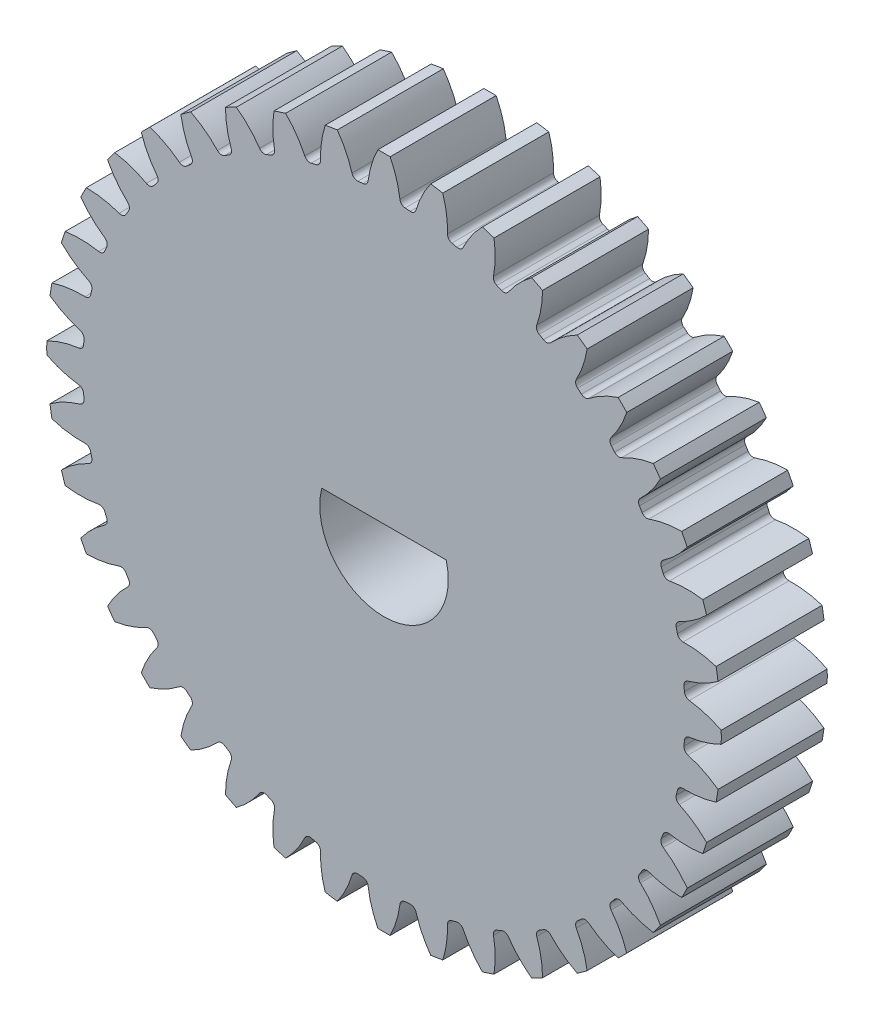
from build123d import *

# Parameters (mm, degrees)
ESQUISSE1_R                        = 1.15
BASE_EXTRUSION_DEPTH               = 2.5
BOSS_EXTRU_1_DEPTH                 = 3.3
CONG_1_R                           = 0.175
R_P_TITION_CIRCULAIRE4_COUNT       = 40
CONG_1_OF_R_P_TITION_CIRCULAIRE4_R = 0.175
ENL_V_MAT_EXTRU_1_DEPTH            = 10


with BuildPart() as part:
    # Esquisse1 → Base-Extrusion (new body)
    with BuildSketch(Plane.XY):
        Circle(ESQUISSE1_R)
    extrude(amount=BASE_EXTRUSION_DEPTH)

    # Esquisse3 → Boss.-Extru.1 (add)
    with BuildSketch(Plane.XY):
        with BuildLine():
            Line((-0.735554022, 9.346100004), (0, 0))
            Line((0, 0), (0.735554022, 9.346100004))
            ThreePointArc((0.735554022, 9.346100004), (0.623147079, 9.354267086), (0.510650079, 9.361082282))
            ThreePointArc((0.510650079, 9.361082282), (0.406217794, 9.945410374), (0.190155724, 10.498277992))
            ThreePointArc((0.190155724, 10.498277992), (0, 10.5), (-0.190155724, 10.498277992))
            ThreePointArc((-0.190155724, 10.498277992), (-0.406217794, 9.945410374), (-0.510650079, 9.361082282))
            ThreePointArc((-0.510650079, 9.361082282), (-0.623147079, 9.354267086), (-0.735554022, 9.346100004))
        make_face()
    boss_extru_1 = extrude(amount=BOSS_EXTRU_1_DEPTH)

    # Congé1
    cong_1_edges = [part.edges().sort_by_distance(p)[0] for p in [
        (0.510650079, 9.361082282, 1.65),
        (-0.510650079, 9.361082282, 1.65),
    ]]
    fillet(cong_1_edges, radius=CONG_1_R)

    # Répétition circulaire4: Boss.-Extru.1 ×40 about axis
    r_p_tition_circulaire4_axis = Axis((0, 0, 53.3), (0, 0, -1))
    for i in range(1, R_P_TITION_CIRCULAIRE4_COUNT):
        add(boss_extru_1.rotate(r_p_tition_circulaire4_axis, i * 360 / R_P_TITION_CIRCULAIRE4_COUNT))

    # Congé1 of Répétition circulaire4
    cong_1_of_r_p_tition_circulaire4_edges = [part.edges().sort_by_distance(p)[0] for p in [
        (1.968759028, 9.165948554, 1.65),
        (0.96003277, 9.325715098, 1.65),
        (3.378390596, 8.745118752, 1.65),
        (2.407076426, 9.060717857, 1.65),
        (4.704834975, 8.108955103, 1.65),
        (3.794849872, 8.572615672, 1.65),
        (5.915430703, 7.273122067, 1.65),
        (5.089181519, 7.873427238, 1.65),
        (6.980368895, 6.258200628, 1.65),
        (6.258200628, 6.980368895, 1.65),
        (7.873427238, 5.089181519, 1.65),
        (7.273122067, 5.915430703, 1.65),
        (8.572615672, 3.794849872, 1.65),
        (8.108955103, 4.704834975, 1.65),
        (9.060717857, 2.407076426, 1.65),
        (8.745118752, 3.378390596, 1.65),
        (9.325715098, 0.96003277, 1.65),
        (9.165948554, 1.968759028, 1.65),
        (9.361082282, -0.510650079, 1.65),
        (9.361082282, 0.510650079, 1.65),
        (9.165948554, -1.968759028, 1.65),
        (9.325715098, -0.96003277, 1.65),
        (8.745118752, -3.378390596, 1.65),
        (9.060717857, -2.407076426, 1.65),
        (8.108955103, -4.704834975, 1.65),
        (8.572615672, -3.794849872, 1.65),
        (7.273122067, -5.915430703, 1.65),
        (7.873427238, -5.089181519, 1.65),
        (6.258200628, -6.980368895, 1.65),
        (6.980368895, -6.258200628, 1.65),
        (5.089181519, -7.873427238, 1.65),
        (5.915430703, -7.273122067, 1.65),
        (3.794849872, -8.572615672, 1.65),
        (4.704834975, -8.108955103, 1.65),
        (2.407076426, -9.060717857, 1.65),
        (3.378390596, -8.745118752, 1.65),
        (0.96003277, -9.325715098, 1.65),
        (1.968759028, -9.165948554, 1.65),
        (-0.510650079, -9.361082282, 1.65),
        (0.510650079, -9.361082282, 1.65),
        (-1.968759028, -9.165948554, 1.65),
        (-0.96003277, -9.325715098, 1.65),
        (-3.378390596, -8.745118752, 1.65),
        (-2.407076426, -9.060717857, 1.65),
        (-4.704834975, -8.108955103, 1.65),
        (-3.794849872, -8.572615672, 1.65),
        (-5.915430703, -7.273122067, 1.65),
        (-5.089181519, -7.873427238, 1.65),
        (-6.980368895, -6.258200628, 1.65),
        (-6.258200628, -6.980368895, 1.65),
        (-7.873427238, -5.089181519, 1.65),
        (-7.273122067, -5.915430703, 1.65),
        (-8.572615672, -3.794849872, 1.65),
        (-8.108955103, -4.704834975, 1.65),
        (-9.060717857, -2.407076426, 1.65),
        (-8.745118752, -3.378390596, 1.65),
        (-9.325715098, -0.96003277, 1.65),
        (-9.165948554, -1.968759028, 1.65),
        (-9.361082282, 0.510650079, 1.65),
        (-9.361082282, -0.510650079, 1.65),
        (-9.165948554, 1.968759028, 1.65),
        (-9.325715098, 0.96003277, 1.65),
        (-8.745118752, 3.378390596, 1.65),
        (-9.060717857, 2.407076426, 1.65),
        (-8.108955103, 4.704834975, 1.65),
        (-8.572615672, 3.794849872, 1.65),
        (-7.273122067, 5.915430703, 1.65),
        (-7.873427238, 5.089181519, 1.65),
        (-6.258200628, 6.980368895, 1.65),
        (-6.980368895, 6.258200628, 1.65),
        (-5.089181519, 7.873427238, 1.65),
        (-5.915430703, 7.273122067, 1.65),
        (-3.794849872, 8.572615672, 1.65),
        (-4.704834975, 8.108955103, 1.65),
        (-2.407076426, 9.060717857, 1.65),
        (-3.378390596, 8.745118752, 1.65),
        (-0.96003277, 9.325715098, 1.65),
        (-1.968759028, 9.165948554, 1.65),
    ]]
    fillet(cong_1_of_r_p_tition_circulaire4_edges, radius=CONG_1_OF_R_P_TITION_CIRCULAIRE4_R)

    # Esquisse4 → Enlèv. mat.-Extru.1 (cut)
    with BuildSketch(Plane.XY.offset(3.3)):
        with BuildLine():
            Line((-1.936491673, 0.5), (1.936491673, 0.5))
            ThreePointArc((1.936491673, 0.5), (0, -2), (-1.936491673, 0.5))
        make_face()
    extrude(amount=-ENL_V_MAT_EXTRU_1_DEPTH, mode=Mode.SUBTRACT)


solid = part.part
